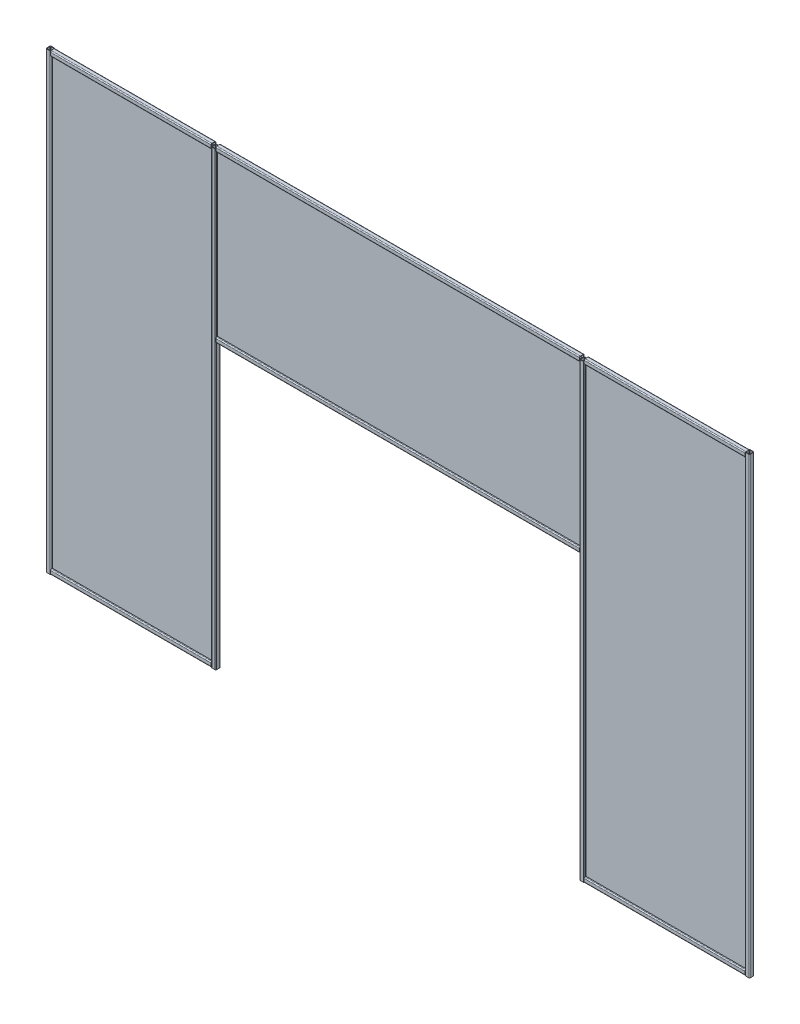
from build123d import *

# Parameters (mm, degrees)
SQUARE_START                                 = -690
SQUARE_TUBE_CONFIGURED_20_X_20_X_2_1_DEPTH   = 680
SQUARE_START_2                               = 10
SQUARE_TUBE_CONFIGURED_20_X_20_X_2_1_2_DEPTH = 1540
SQUARE_START_3                               = -10
SQUARE_TUBE_CONFIGURED_20_X_20_X_2_1_3_DEPTH = 1910
SQUARE_START_4                               = -689.95
SQUARE_TUBE_CONFIGURED_20_X_20_X_2_1_4_DEPTH = 679.9
SQUARE_TUBE_CONFIGURED_20_X_20_X_2_1_5_DEPTH = 1920
SQUARE_START_5                               = 1570
SQUARE_TUBE_CONFIGURED_20_X_20_X_2_1_6_DEPTH = 680
SQUARE_TUBE_CONFIGURED_20_X_20_X_2_1_7_DEPTH = 1910
SQUARE_START_6                               = 1570.05
SQUARE_TUBE_CONFIGURED_20_X_20_X_2_1_8_DEPTH = 679.9
SQUARE_TUBE_CONFIGURED_20_X_20_X_2_1_9_DEPTH = 1920
SQUARE_START_7                               = 10.05
SQUARE_TUBE_CONFIGURED_20_X_20_X_2_1_1_DEPTH = 1539.9
SZKIC2_W                                     = 679.95
SZKIC2_H                                     = 1880
DODANIE_WYCI_GNI_CIE1_DEPTH                  = 2
SZKIC2_W_2                                   = 1539.95
SZKIC2_H_2                                   = 680
DODANIE_WYCI_GNI_CIE1_2_DEPTH                = 2
DODANIE_WYCI_GNI_CIE1_3_DEPTH                = 2


# Read off the part's stored shape, not the designer's step: Square tube - configured 20 X 20 X 2(1)
with BuildPart() as part:
    # Square tube - configured 20 X 20 X 2(1) o → Square tube - configured 20 X 20 X 2(1) (new body)
    with BuildSketch(Plane.YZ.offset(SQUARE_START)):
        with BuildLine():
            ThreePointArc((1906, -10), (1908.828427125, -8.828427125), (1910, -6))
            Line((1910, -6), (1910, 6))
            ThreePointArc((1910, 6), (1908.828427125, 8.828427125), (1906, 10))
            Line((1906, 10), (1894, 10))
            ThreePointArc((1894, 10), (1891.171572875, 8.828427125), (1890, 6))
            Line((1890, 6), (1890, -6))
            ThreePointArc((1890, -6), (1891.171572875, -8.828427125), (1894, -10))
            Line((1894, -10), (1906, -10))
        make_face()
        with BuildLine():
            Line((1894, 8), (1906, 8))
            ThreePointArc((1906, 8), (1907.414213562, 7.414213562), (1908, 6))
            Line((1908, 6), (1908, -6))
            ThreePointArc((1908, -6), (1907.414213562, -7.414213562), (1906, -8))
            Line((1906, -8), (1894, -8))
            ThreePointArc((1894, -8), (1892.585786438, -7.414213562), (1892, -6))
            Line((1892, -6), (1892, 6))
            ThreePointArc((1892, 6), (1892.585786438, 7.414213562), (1894, 8))
        make_face(mode=Mode.SUBTRACT)
    extrude(amount=SQUARE_TUBE_CONFIGURED_20_X_20_X_2_1_DEPTH)


with BuildPart() as body_2:
    # Square tube - configured 20 X 20 X 2 2 → Square tube - configured 20 X 20 X 2_1 2 (new body)
    with BuildSketch(Plane.YZ.offset(SQUARE_START_2)):
        with BuildLine():
            ThreePointArc((1906, -10), (1908.828427125, -8.828427125), (1910, -6))
            Line((1910, -6), (1910, 6))
            ThreePointArc((1910, 6), (1908.828427125, 8.828427125), (1906, 10))
            Line((1906, 10), (1894, 10))
            ThreePointArc((1894, 10), (1891.171572875, 8.828427125), (1890, 6))
            Line((1890, 6), (1890, -6))
            ThreePointArc((1890, -6), (1891.171572875, -8.828427125), (1894, -10))
            Line((1894, -10), (1906, -10))
        make_face()
        with BuildLine():
            Line((1894, 8), (1906, 8))
            ThreePointArc((1906, 8), (1907.414213562, 7.414213562), (1908, 6))
            Line((1908, 6), (1908, -6))
            ThreePointArc((1908, -6), (1907.414213562, -7.414213562), (1906, -8))
            Line((1906, -8), (1894, -8))
            ThreePointArc((1894, -8), (1892.585786438, -7.414213562), (1892, -6))
            Line((1892, -6), (1892, 6))
            ThreePointArc((1892, 6), (1892.585786438, 7.414213562), (1894, 8))
        make_face(mode=Mode.SUBTRACT)
    extrude(amount=SQUARE_TUBE_CONFIGURED_20_X_20_X_2_1_2_DEPTH)


with BuildPart() as body_3:
    # Square tube - configured 20 X 20 X 2 3 → Square tube - configured 20 X 20 X 2_1 3 (new body)
    with BuildSketch(Plane(origin=(0, 0, 0), x_dir=(1, 0, 0), z_dir=(0, 1, 0)).offset(SQUARE_START_3)):
        with BuildLine():
            Line((-6, -10), (6, -10))
            ThreePointArc((6, -10), (8.828427125, -8.828427125), (10, -6))
            Line((10, -6), (10, 6))
            ThreePointArc((10, 6), (8.828427125, 8.828427125), (6, 10))
            Line((6, 10), (-6, 10))
            ThreePointArc((-6, 10), (-8.828427125, 8.828427125), (-10, 6))
            Line((-10, 6), (-10, -6))
            ThreePointArc((-10, -6), (-8.828427125, -8.828427125), (-6, -10))
        make_face()
        with BuildLine():
            ThreePointArc((-6, -8), (-7.414213562, -7.414213562), (-8, -6))
            Line((-8, -6), (-8, 6))
            ThreePointArc((-8, 6), (-7.414213562, 7.414213562), (-6, 8))
            Line((-6, 8), (6, 8))
            ThreePointArc((6, 8), (7.414213562, 7.414213562), (8, 6))
            Line((8, 6), (8, -6))
            ThreePointArc((8, -6), (7.414213562, -7.414213562), (6, -8))
            Line((6, -8), (-6, -8))
        make_face(mode=Mode.SUBTRACT)
    extrude(amount=SQUARE_TUBE_CONFIGURED_20_X_20_X_2_1_3_DEPTH)


with BuildPart() as body_4:
    # Square tube - configured 20 X 20 X 2 4 → Square tube - configured 20 X 20 X 2_1 4 (new body)
    with BuildSketch(Plane.YZ.offset(SQUARE_START_4)):
        with BuildLine():
            Line((6, 10), (-6, 10))
            ThreePointArc((-6, 10), (-8.828427125, 8.828427125), (-10, 6))
            Line((-10, 6), (-10, -6))
            ThreePointArc((-10, -6), (-8.828427125, -8.828427125), (-6, -10))
            Line((-6, -10), (6, -10))
            ThreePointArc((6, -10), (8.828427125, -8.828427125), (10, -6))
            Line((10, -6), (10, 6))
            ThreePointArc((10, 6), (8.828427125, 8.828427125), (6, 10))
        make_face()
        with BuildLine():
            ThreePointArc((8, -6), (7.414213562, -7.414213562), (6, -8))
            Line((6, -8), (-6, -8))
            ThreePointArc((-6, -8), (-7.414213562, -7.414213562), (-8, -6))
            Line((-8, -6), (-8, 6))
            ThreePointArc((-8, 6), (-7.414213562, 7.414213562), (-6, 8))
            Line((-6, 8), (6, 8))
            ThreePointArc((6, 8), (7.414213562, 7.414213562), (8, 6))
            Line((8, 6), (8, -6))
        make_face(mode=Mode.SUBTRACT)
    extrude(amount=SQUARE_TUBE_CONFIGURED_20_X_20_X_2_1_4_DEPTH)


with BuildPart() as body_5:
    # Square tube - configured 20 X 20 X 2 5 → Square tube - configured 20 X 20 X 2_1 5 (new body)
    with BuildSketch(Plane(origin=(0, 0, 0), x_dir=(1, 0, 0), z_dir=(0, 1, 0)).offset(SQUARE_START_3)):
        with BuildLine():
            ThreePointArc((-690, 6), (-691.171572875, 8.828427125), (-694, 10))
            Line((-694, 10), (-706, 10))
            ThreePointArc((-706, 10), (-708.828427125, 8.828427125), (-710, 6))
            Line((-710, 6), (-710, -6))
            ThreePointArc((-710, -6), (-708.828427125, -8.828427125), (-706, -10))
            Line((-706, -10), (-694, -10))
            ThreePointArc((-694, -10), (-691.171572875, -8.828427125), (-690, -6))
            Line((-690, -6), (-690, 6))
        make_face()
        with BuildLine():
            Line((-708, -6), (-708, 6))
            ThreePointArc((-708, 6), (-707.414213562, 7.414213562), (-706, 8))
            Line((-706, 8), (-694, 8))
            ThreePointArc((-694, 8), (-692.585786438, 7.414213562), (-692, 6))
            Line((-692, 6), (-692, -6))
            ThreePointArc((-692, -6), (-692.585786438, -7.414213562), (-694, -8))
            Line((-694, -8), (-706, -8))
            ThreePointArc((-706, -8), (-707.414213562, -7.414213562), (-708, -6))
        make_face(mode=Mode.SUBTRACT)
    extrude(amount=SQUARE_TUBE_CONFIGURED_20_X_20_X_2_1_5_DEPTH)


with BuildPart() as body_6:
    # Square tube - configured 20 X 20 X 2 6 → Square tube - configured 20 X 20 X 2_1 6 (new body)
    with BuildSketch(Plane.YZ.offset(SQUARE_START_5)):
        with BuildLine():
            Line((1894, -10), (1906, -10))
            ThreePointArc((1906, -10), (1908.828427125, -8.828427125), (1910, -6))
            Line((1910, -6), (1910, 6))
            ThreePointArc((1910, 6), (1908.828427125, 8.828427125), (1906, 10))
            Line((1906, 10), (1894, 10))
            ThreePointArc((1894, 10), (1891.171572875, 8.828427125), (1890, 6))
            Line((1890, 6), (1890, -6))
            ThreePointArc((1890, -6), (1891.171572875, -8.828427125), (1894, -10))
        make_face()
        with BuildLine():
            ThreePointArc((1892, 6), (1892.585786438, 7.414213562), (1894, 8))
            Line((1894, 8), (1906, 8))
            ThreePointArc((1906, 8), (1907.414213562, 7.414213562), (1908, 6))
            Line((1908, 6), (1908, -6))
            ThreePointArc((1908, -6), (1907.414213562, -7.414213562), (1906, -8))
            Line((1906, -8), (1894, -8))
            ThreePointArc((1894, -8), (1892.585786438, -7.414213562), (1892, -6))
            Line((1892, -6), (1892, 6))
        make_face(mode=Mode.SUBTRACT)
    extrude(amount=SQUARE_TUBE_CONFIGURED_20_X_20_X_2_1_6_DEPTH)


with BuildPart() as body_7:
    # Square tube - configured 20 X 20 X 2 7 → Square tube - configured 20 X 20 X 2_1 7 (new body)
    with BuildSketch(Plane(origin=(0, 0, 0), x_dir=(1, 0, 0), z_dir=(0, 1, 0)).offset(SQUARE_START_3)):
        with BuildLine():
            ThreePointArc((1570, 6), (1568.828427125, 8.828427125), (1566, 10))
            Line((1566, 10), (1554, 10))
            ThreePointArc((1554, 10), (1551.171572875, 8.828427125), (1550, 6))
            Line((1550, 6), (1550, -6))
            ThreePointArc((1550, -6), (1551.171572875, -8.828427125), (1554, -10))
            Line((1554, -10), (1566, -10))
            ThreePointArc((1566, -10), (1568.828427125, -8.828427125), (1570, -6))
            Line((1570, -6), (1570, 6))
        make_face()
        with BuildLine():
            Line((1552, -6), (1552, 6))
            ThreePointArc((1552, 6), (1552.585786438, 7.414213562), (1554, 8))
            Line((1554, 8), (1566, 8))
            ThreePointArc((1566, 8), (1567.414213562, 7.414213562), (1568, 6))
            Line((1568, 6), (1568, -6))
            ThreePointArc((1568, -6), (1567.414213562, -7.414213562), (1566, -8))
            Line((1566, -8), (1554, -8))
            ThreePointArc((1554, -8), (1552.585786438, -7.414213562), (1552, -6))
        make_face(mode=Mode.SUBTRACT)
    extrude(amount=SQUARE_TUBE_CONFIGURED_20_X_20_X_2_1_7_DEPTH)


with BuildPart() as body_8:
    # Square tube - configured 20 X 20 X 2 8 → Square tube - configured 20 X 20 X 2_1 8 (new body)
    with BuildSketch(Plane.YZ.offset(SQUARE_START_6)):
        with BuildLine():
            Line((6, 10), (-6, 10))
            ThreePointArc((-6, 10), (-8.828427125, 8.828427125), (-10, 6))
            Line((-10, 6), (-10, -6))
            ThreePointArc((-10, -6), (-8.828427125, -8.828427125), (-6, -10))
            Line((-6, -10), (6, -10))
            ThreePointArc((6, -10), (8.828427125, -8.828427125), (10, -6))
            Line((10, -6), (10, 6))
            ThreePointArc((10, 6), (8.828427125, 8.828427125), (6, 10))
        make_face()
        with BuildLine():
            ThreePointArc((8, -6), (7.414213562, -7.414213562), (6, -8))
            Line((6, -8), (-6, -8))
            ThreePointArc((-6, -8), (-7.414213562, -7.414213562), (-8, -6))
            Line((-8, -6), (-8, 6))
            ThreePointArc((-8, 6), (-7.414213562, 7.414213562), (-6, 8))
            Line((-6, 8), (6, 8))
            ThreePointArc((6, 8), (7.414213562, 7.414213562), (8, 6))
            Line((8, 6), (8, -6))
        make_face(mode=Mode.SUBTRACT)
    extrude(amount=SQUARE_TUBE_CONFIGURED_20_X_20_X_2_1_8_DEPTH)


with BuildPart() as body_9:
    # Square tube - configured 20 X 20 X 2 9 → Square tube - configured 20 X 20 X 2_1 9 (new body)
    with BuildSketch(Plane(origin=(0, 0, 0), x_dir=(1, 0, 0), z_dir=(0, 1, 0)).offset(SQUARE_START_3)):
        with BuildLine():
            ThreePointArc((2270, 6), (2268.828427125, 8.828427125), (2266, 10))
            Line((2266, 10), (2254, 10))
            ThreePointArc((2254, 10), (2251.171572875, 8.828427125), (2250, 6))
            Line((2250, 6), (2250, -6))
            ThreePointArc((2250, -6), (2251.171572875, -8.828427125), (2254, -10))
            Line((2254, -10), (2266, -10))
            ThreePointArc((2266, -10), (2268.828427125, -8.828427125), (2270, -6))
            Line((2270, -6), (2270, 6))
        make_face()
        with BuildLine():
            Line((2252, -6), (2252, 6))
            ThreePointArc((2252, 6), (2252.585786438, 7.414213562), (2254, 8))
            Line((2254, 8), (2266, 8))
            ThreePointArc((2266, 8), (2267.414213562, 7.414213562), (2268, 6))
            Line((2268, 6), (2268, -6))
            ThreePointArc((2268, -6), (2267.414213562, -7.414213562), (2266, -8))
            Line((2266, -8), (2254, -8))
            ThreePointArc((2254, -8), (2252.585786438, -7.414213562), (2252, -6))
        make_face(mode=Mode.SUBTRACT)
    extrude(amount=SQUARE_TUBE_CONFIGURED_20_X_20_X_2_1_9_DEPTH)


with BuildPart() as body_10:
    # Square tube - configured 20 X 20 X 2 10 → Square tube - configured 20 X 20 X 2_1 1 (new body)
    with BuildSketch(Plane.YZ.offset(SQUARE_START_7)):
        with BuildLine():
            Line((1206, 10), (1194, 10))
            ThreePointArc((1194, 10), (1191.171572875, 8.828427125), (1190, 6))
            Line((1190, 6), (1190, -6))
            ThreePointArc((1190, -6), (1191.171572875, -8.828427125), (1194, -10))
            Line((1194, -10), (1206, -10))
            ThreePointArc((1206, -10), (1208.828427125, -8.828427125), (1210, -6))
            Line((1210, -6), (1210, 6))
            ThreePointArc((1210, 6), (1208.828427125, 8.828427125), (1206, 10))
        make_face()
        with BuildLine():
            ThreePointArc((1208, -6), (1207.414213562, -7.414213562), (1206, -8))
            Line((1206, -8), (1194, -8))
            ThreePointArc((1194, -8), (1192.585786438, -7.414213562), (1192, -6))
            Line((1192, -6), (1192, 6))
            ThreePointArc((1192, 6), (1192.585786438, 7.414213562), (1194, 8))
            Line((1194, 8), (1206, 8))
            ThreePointArc((1206, 8), (1207.414213562, 7.414213562), (1208, 6))
            Line((1208, 6), (1208, -6))
        make_face(mode=Mode.SUBTRACT)
    extrude(amount=SQUARE_TUBE_CONFIGURED_20_X_20_X_2_1_1_DEPTH)


with BuildPart() as body_11:
    # Szkic2 → Dodanie-wyciągnięcie1 (new body)
    with BuildSketch(Plane.XY):
        with Locations((-350.025, 950)):
            Rectangle(SZKIC2_W, SZKIC2_H)
    extrude(amount=DODANIE_WYCI_GNI_CIE1_DEPTH)


with BuildPart() as body_12:
    # Szkic2 → Dodanie-wyci_gni_cie1 2 (new body)
    with BuildSketch(Plane.XY):
        with Locations((780.025, 1550)):
            Rectangle(SZKIC2_W_2, SZKIC2_H_2)
    extrude(amount=DODANIE_WYCI_GNI_CIE1_2_DEPTH)


with BuildPart() as body_13:
    # Szkic2 → Dodanie-wyci_gni_cie1 3 (new body)
    with BuildSketch(Plane.XY):
        with Locations((1909.975, 950)):
            Rectangle(SZKIC2_W, SZKIC2_H)
    extrude(amount=DODANIE_WYCI_GNI_CIE1_3_DEPTH)


solid = Compound([part.part, body_2.part, body_3.part, body_4.part, body_5.part, body_6.part, body_7.part, body_8.part, body_9.part, body_10.part, body_11.part, body_12.part, body_13.part])
